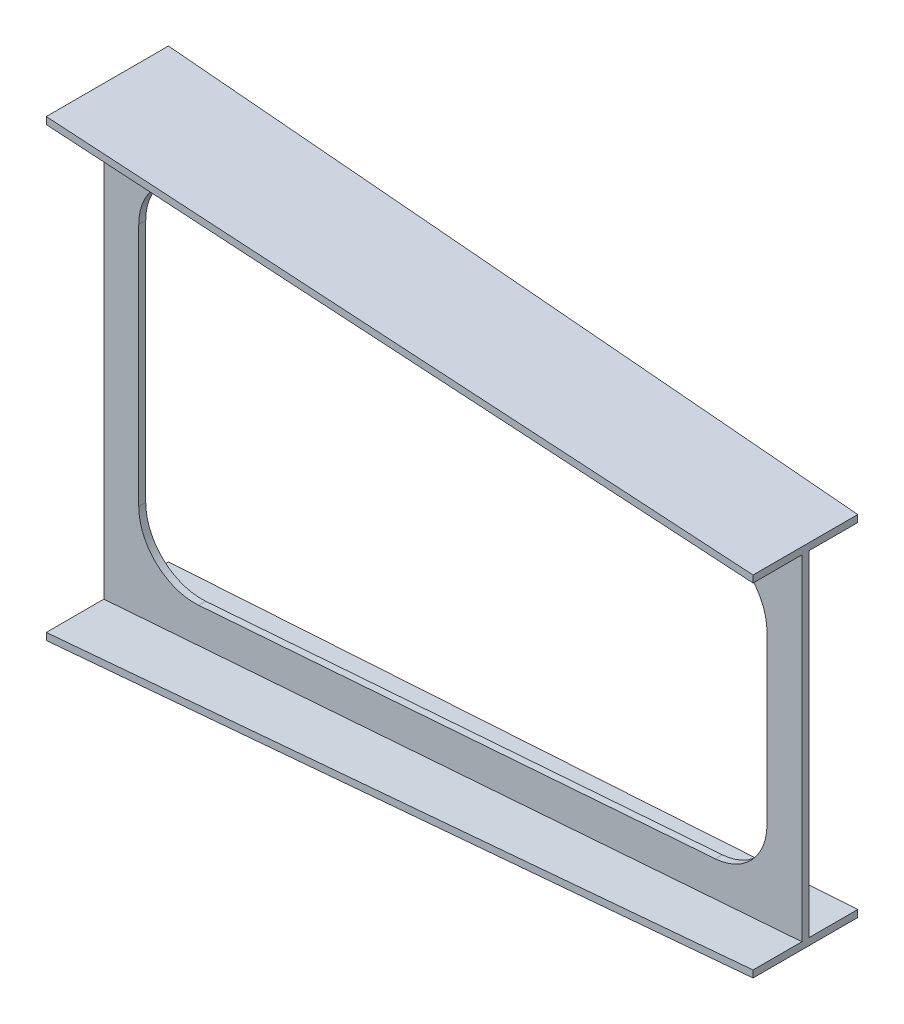
from build123d import *

# Parameters (mm, degrees)
CUT_EXTRUDE1_DEPTH = 1056.547843673


with BuildPart() as part:
    # Sketch1 → Loft l2 section 0
    with BuildSketch(Plane(origin=(0, 0, 0), x_dir=(0, 0, -1), z_dir=(1, 0, 0))):
        with BuildLine():
            Line((-92.5, 325), (82.5, 325))
            Line((82.5, 325), (82.5, 315))
            Line((82.5, 315), (0, 315))
            Line((0, 315), (0, -315))
            Line((0, -315), (82.5, -315))
            Line((82.5, -315), (82.5, -325))
            Line((82.5, -325), (-92.5, -325))
            Line((-92.5, -325), (-92.5, -315))
            Line((-92.5, -315), (-10, -315))
            Line((-10, -315), (-10, 315))
            Line((-10, 315), (-92.5, 315))
            Line((-92.5, 315), (-92.5, 325))
        make_face()
    # Sketch4 → Loft l2 section 1
    with BuildSketch(Plane(origin=(1000, 0, -1000), x_dir=(0, 0, 1), z_dir=(-1, 0, 0))):
        with BuildLine():
            Line((930, 250), (1080, 250))
            Line((1080, 250), (1080, 240))
            Line((1080, 240), (1010, 240))
            Line((1010, 240), (1010, -240))
            Line((1010, -240), (1080, -240))
            Line((1080, -240), (1080, -250))
            Line((1080, -250), (930, -250))
            Line((930, -250), (930, -240))
            Line((930, -240), (1000, -240))
            Line((1000, -240), (1000, 240))
            Line((1000, 240), (930, 240))
            Line((930, 240), (930, 250))
        make_face()
    loft()

    # Sketch6 → Cut-Extrude1 (cut, through all)
    with BuildSketch(Plane.XY.offset(10)):
        with BuildLine():
            Line((135.983195859, -254.66083251), (875.983195859, -199.16083251))
            ThreePointArc((875.983195859, -199.16083251), (928.64578275, -173.796946728), (950, -119.384887719))
            Line((950, -119.384887719), (950, 119.384887719))
            ThreePointArc((950, 119.384887719), (928.64578275, 173.796946728), (875.983195859, 199.16083251))
            Line((875.983195859, 199.16083251), (135.983195859, 254.66083251))
            ThreePointArc((135.983195859, 254.66083251), (75.587940991, 233.530670469), (50, 174.884887719))
            Line((50, 174.884887719), (50, -174.884887719))
            ThreePointArc((50, -174.884887719), (75.587940991, -233.530670469), (135.983195859, -254.66083251))
        make_face()
    extrude(amount=-CUT_EXTRUDE1_DEPTH, mode=Mode.SUBTRACT)


solid = part.part
